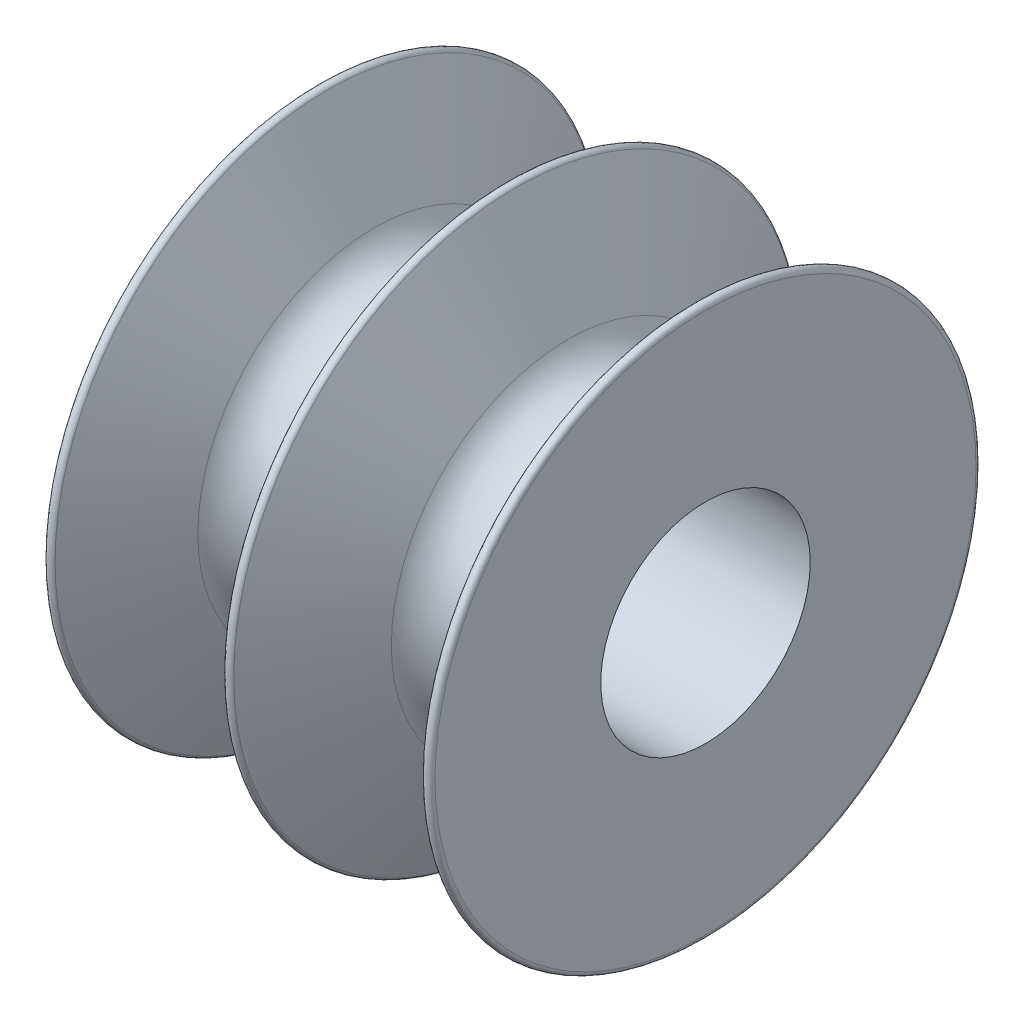
from build123d import *

# Parameters (mm, degrees)
FILLET2_R          = 0.127
SKETCH5_R          = 2.7499945
CUT_EXTRUDE3_DEPTH = 15.677255543


with BuildPart() as part:
    # Sketch1 → Revolve1 (revolve)
    with BuildSketch(Plane.XY, mode=Mode.PRIVATE) as revolve1_sk:
        with BuildLine():
            ThreePointArc((-1.070224719, 4.637640449), (0, 3.96875), (1.070224719, 4.637640449))
            Line((1.070224719, 4.637640449), (1.905, 6.35))
            Line((1.905, 6.35), (1.905, 0))
            Line((1.905, 0), (-1.905, 0))
            Line((-1.905, 0), (-1.905, 6.35))
            Line((-1.905, 6.35), (-1.070224719, 4.637640449))
        make_face()
        Polygon((-2.54, 7.652564103), (-2.54, 0), (-1.905, 0), (-1.905, 6.35), align=None)
        Polygon((1.905, 0), (1.905, 6.35), (2.54, 7.652564103), (2.54, 0), align=None)
    revolve1 = revolve(revolve1_sk.sketch.rotate(Axis((-602.921612104, 0, 0), (1, 0, 0)), 90), axis=Axis((-602.921612104, 0, 0), (1, 0, 0)))

    # Mirror3: Revolve1 across plane
    add(revolve1.mirror(Plane(origin=(2.54, 0, 0), x_dir=(0, 0, 1), z_dir=(1, 0, 0))))

    # Fillet2
    fillet2_edges = [part.edges().sort_by_distance(p)[0] for p in [
        (7.62, 0, -7.652564103),
        (2.54, 0, -7.652564103),
        (-2.54, 0, -7.652564103),
    ]]
    fillet(fillet2_edges, radius=FILLET2_R - 0.0001)  # a hair under: the kernel refuses the full size

    # Sketch5 → Cut-Extrude3 (cut, through all)
    with BuildSketch(Plane(origin=(7.62, 0, 0), x_dir=(0, 0, -1), z_dir=(1, 0, 0))):
        Circle(SKETCH5_R)
    extrude(amount=-CUT_EXTRUDE3_DEPTH, mode=Mode.SUBTRACT)


solid = part.part
